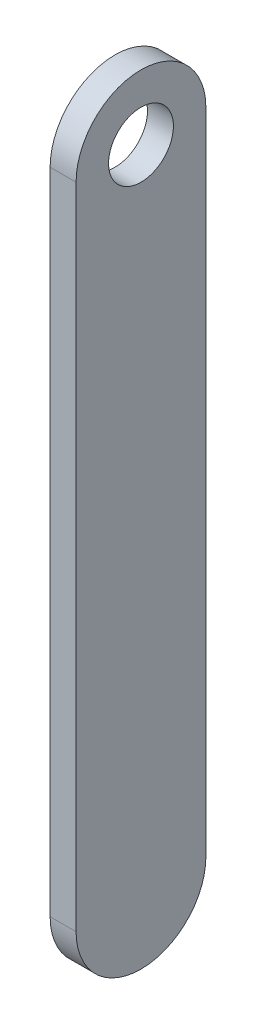
from build123d import *

# Parameters (mm, degrees)
BOSS_EXTRUDE1_DEPTH      = 4
BOSS_EXTRUDE1_DEPTH_BACK = 4
SKETCH2_R                = 10


with BuildPart() as part:
    # Sketch2 → Boss-Extrude1 (new, two sides: drawn at the far end of the back side and taken through both)
    with BuildSketch(Plane(origin=(0, 0, 0), x_dir=(0, 0, -1), z_dir=(1, 0, 0)).offset(-BOSS_EXTRUDE1_DEPTH_BACK)):
        with BuildLine():
            Line((20, -200), (20, 0))
            ThreePointArc((20, 0), (0, 20), (-20, 0))
            Line((-20, 0), (-20, -200))
            ThreePointArc((-20, -200), (0, -220), (20, -200))
        make_face()
        Circle(SKETCH2_R, mode=Mode.SUBTRACT)
    extrude(amount=BOSS_EXTRUDE1_DEPTH + BOSS_EXTRUDE1_DEPTH_BACK)


solid = part.part
